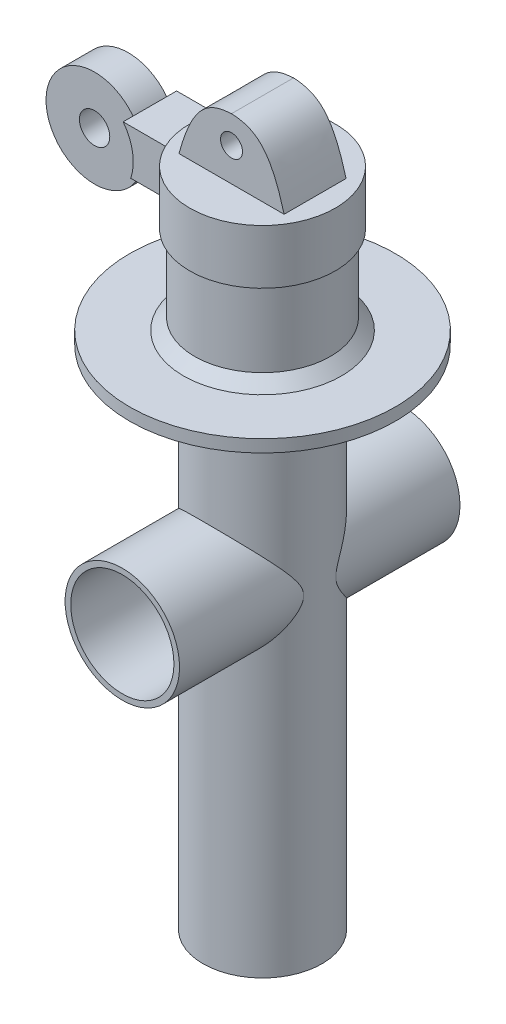
from build123d import *

# Parameters (mm, degrees)
SKETCH7_R           = 21.1979112
BOSS_EXTRUDE1_DEPTH = 180.647627
SKETCH12_R          = 20.406966807
BOSS_EXTRUDE6_DEPTH = 50
SHELL1_START        = -50
SHELL1_OUTLINE_R    = 18.406966807
SHELL1_DEPTH        = 100
SHELL1_2_OUTLINE_R  = 19.1979112
SHELL1_2_DEPTH      = 178.6476265
SKETCH8_R           = 47.3804642
BOSS_EXTRUDE2_DEPTH = 4.431169
SKETCH9_R           = 24.21431875
BOSS_EXTRUDE3_DEPTH = 31.309755
SKETCH10_R          = 25.98338315
BOSS_EXTRUDE4_DEPTH = 19.395214
CHAMFER1_SIZE       = 4
SKETCH11_R          = 3.909700179
BOSS_EXTRUDE5_DEPTH = 11.05
SKETCH13_W          = 19.064805676
SKETCH13_H          = 16.075701836
BOSS_EXTRUDE7_DEPTH = 52
SKETCH14_R          = 17.318879346
SKETCH14_R_2        = 11.636848892
SKETCH14_R_3        = 5.411731441
CUT_EXTRUDE1_DEPTH  = 26
SKETCH14_5_R        = 17.318879346
SKETCH14_5_R_2      = 5.411731441
BOSS_EXTRUDE9_DEPTH = 6


with BuildPart() as part:
    # Sketch7 → Boss-Extrude1 (new body)
    with BuildSketch(Plane(origin=(0, 0, 0), x_dir=(1, 0, 0), z_dir=(0, 1, 0))):
        with Locations(Location((0, 0, 0), (0, 0, 270))):
            Circle(SKETCH7_R)
    extrude(amount=BOSS_EXTRUDE1_DEPTH)

    # Sketch12 → Boss-Extrude6 (add, symmetric)
    with BuildSketch(Plane.XY):
        with Locations((0, 116.195122616)):
            Circle(SKETCH12_R)
    extrude(amount=BOSS_EXTRUDE6_DEPTH, both=True)

    # Shell1: read off the stored shape, not the designer's step
    # Shell1 outline → Shell1 (cut)
    with BuildSketch(Plane.XY.offset(SHELL1_START)):
        with Locations((0, 116.195122616)):
            Circle(SHELL1_OUTLINE_R)
    extrude(amount=SHELL1_DEPTH, mode=Mode.SUBTRACT)

    # Shell1 2 outline → Shell1 2 (cut)
    with BuildSketch(Plane(origin=(0, 0, 0), x_dir=(1, 0, 0), z_dir=(0, 1, 0))):
        Circle(SHELL1_2_OUTLINE_R)
    extrude(amount=SHELL1_2_DEPTH, mode=Mode.SUBTRACT)

    # Sketch8 → Boss-Extrude2 (add)
    with BuildSketch(Plane(origin=(0, 180.6476265, 0), x_dir=(1, 0, 0), z_dir=(0, 1, 0))):
        with Locations(Location((0, 0, 0), (0, 0, 270))):
            Circle(SKETCH8_R)
    extrude(amount=BOSS_EXTRUDE2_DEPTH)

    # Sketch9 → Boss-Extrude3 (add)
    with BuildSketch(Plane(origin=(0, 185.0787951, 0), x_dir=(1, 0, 0), z_dir=(0, 1, 0))):
        with Locations(Location((0, 0, 0), (0, 0, 270))):
            Circle(SKETCH9_R)
    extrude(amount=BOSS_EXTRUDE3_DEPTH)

    # Sketch10 → Boss-Extrude4 (add)
    with BuildSketch(Plane(origin=(0, 216.3885498, 0), x_dir=(1, 0, 0), z_dir=(0, 1, 0))):
        with Locations(Location((0, 0, 0), (0, 0, 270))):
            Circle(SKETCH10_R)
    extrude(amount=BOSS_EXTRUDE4_DEPTH)

    # Chamfer1
    chamfer1_edges = [part.edges().sort_by_distance(p)[0] for p in [
        (0, 185.0787951, -24.21431875),
    ]]
    chamfer(chamfer1_edges, length=CHAMFER1_SIZE)

    # Sketch11 → Boss-Extrude5 (add, symmetric)
    with BuildSketch(Plane.XY):
        with BuildLine():
            Line((-18.74694623, 235.7837635), (18.74694623, 235.7837635))
            add(Edge.make_bspline(
                [(18.74694623, 235.7837635), (13.888692834, 253.685965272), (8.293919463, 257.014643256), (0, 257.491213049)],
                knots=[0, 0, 0, 0, 0.516374354, 0.516374354, 0.516374354, 0.516374354], degree=3))
            add(Edge.make_bspline(
                [(-18.74694623, 235.7837635), (-13.888692834, 253.685965272), (-8.293919463, 257.014643256), (0, 257.491213049)],
                knots=[0, 0, 0, 0, 0.516374354, 0.516374354, 0.516374354, 0.516374354], degree=3))
        make_face()
        with Locations((0, 247.681579845)):
            Circle(SKETCH11_R, mode=Mode.SUBTRACT)
    extrude(amount=BOSS_EXTRUDE5_DEPTH, both=True)

    # Sketch13 → Boss-Extrude7 (add)
    with BuildSketch(Plane(origin=(0, 0, 0), x_dir=(0, 0, -1), z_dir=(1, 0, 0))):
        with Locations((0, 226.08615665)):
            Rectangle(SKETCH13_W, SKETCH13_H)
    extrude(amount=-BOSS_EXTRUDE7_DEPTH)

    # Sketch14 → Cut-Extrude1 (cut, symmetric)
    # profile 1 of 2: a face of its own
    with BuildSketch(Plane.XY):
        with Locations((-53.889606886, 223.55520268)):
            Circle(SKETCH14_R)
        with Locations((-53.889606886, 223.55520268)):
            Circle(SKETCH14_R_2, mode=Mode.SUBTRACT)
    # profile 2 of 2: a face of its own
    with BuildSketch(Plane.XY):
        with Locations((-53.889606886, 223.55520268)):
            Circle(SKETCH14_R_3)
    extrude(amount=CUT_EXTRUDE1_DEPTH, both=True, mode=Mode.SUBTRACT)


with BuildPart() as cut_extrude1_kept_piece:
    # of the separate pieces the step leaves, the one the design keeps (cut_extrude1_pieces_kept)
    add(part.part.solids().sort_by_distance((0, 189.0787955, 24.21431875))[0])

    # Sketch14<5> → Boss-Extrude9 (add, symmetric)
    with BuildSketch(Plane.XY):
        with Locations((-53.889606886, 223.55520268)):
            Circle(SKETCH14_5_R)
        with Locations((-53.889606886, 223.55520268)):
            Circle(SKETCH14_5_R_2, mode=Mode.SUBTRACT)
    extrude(amount=BOSS_EXTRUDE9_DEPTH, both=True)


solid = cut_extrude1_kept_piece.part
